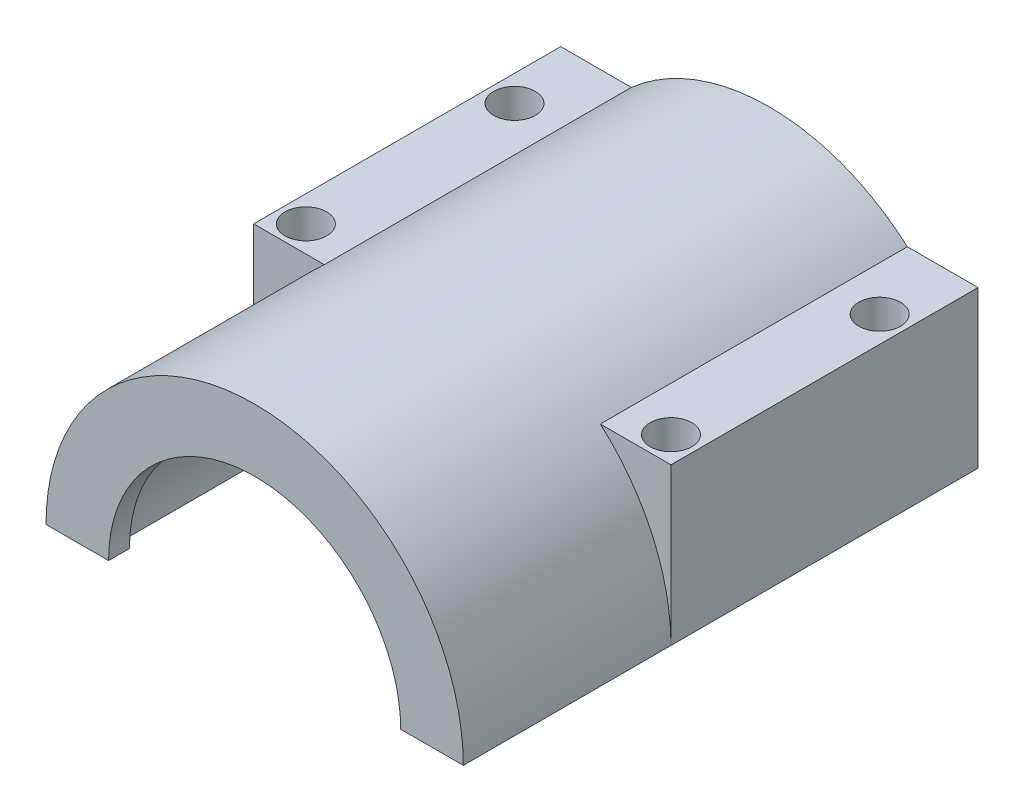
from build123d import *

# Parameters (mm, degrees)
BOSS_EXTRUDE1_DEPTH      = 52.578
BOSS_EXTRUDE2_START      = 5
BOSS_EXTRUDE2_DEPTH      = 5
SKETCH4_R                = 2.54
CUT_EXTRUDE1_DEPTH       = 64.677045189
SKETCH5_R                = 3.175
SKETCH5_R_2              = 2.54
BOSS_EXTRUDE3_DEPTH      = 19.05
BOSS_EXTRUDE4_REACH      = 63.421
BOSS_EXTRUDE4_END_RADIUS = 25.4
SKETCH6_W                = 8.89
SKETCH6_H                = 37.375
SKETCH6_R                = 2.54
BOSS_EXTRUDE5_DEPTH      = 2.54
BOSS_EXTRUDE6_DEPTH      = 2.54


with BuildPart() as part:
    # Sketch2 → Boss-Extrude1 (new body)
    with BuildSketch(Plane.XY):
        with BuildLine():
            Line((-19.05, 0), (-25.4, 0))
            ThreePointArc((-25.4, 0), (0, 25.4), (25.4, 0))
            Line((25.4, 0), (19.05, 0))
            ThreePointArc((19.05, 0), (0, 19.05), (-19.05, 0))
        make_face()
    extrude(amount=BOSS_EXTRUDE1_DEPTH)

    # Sketch3 → Boss-Extrude2 (add)
    with BuildSketch(Plane(origin=(0, 0, 0), x_dir=(-1, 0, 0), z_dir=(0, 0, -1)).offset(BOSS_EXTRUDE2_START)):
        with BuildLine():
            Line((-25.4, 0), (-13, 0))
            ThreePointArc((-13, 0), (-7, 6), (-1, 0))
            Line((-1, 0), (25.4, 0))
            ThreePointArc((25.4, 0), (0, 25.4), (-25.4, 0))
        make_face()
    extrude(amount=-BOSS_EXTRUDE2_DEPTH)

    # Sketch4 → Cut-Extrude1 (cut, through all)
    with BuildSketch(Plane(origin=(0, 0, 0), x_dir=(1, 0, 0), z_dir=(0, 1, 0))):
        with Locations((-22.225, -3.8)):
            Circle(SKETCH4_R)
        with Locations((22.225, -3.8)):
            Circle(SKETCH4_R)
        with Locations((22.225, -29.2)):
            Circle(SKETCH4_R)
        with Locations((-22.225, -29.2)):
            Circle(SKETCH4_R)
    extrude(amount=CUT_EXTRUDE1_DEPTH, mode=Mode.SUBTRACT)

    # Sketch5 → Boss-Extrude3 (add)
    # profile 1 of 4: a face of its own
    with BuildSketch(Plane.XZ):
        with Locations((-22.225, 29.2)):
            Circle(SKETCH5_R)
        with Locations((-22.225, 29.2)):
            Circle(SKETCH5_R_2, mode=Mode.SUBTRACT)
    # profile 2 of 4: a face of its own
    with BuildSketch(Plane.XZ):
        with Locations((-22.225, 3.8)):
            Circle(SKETCH5_R)
        with Locations((-22.225, 3.8)):
            Circle(SKETCH5_R_2, mode=Mode.SUBTRACT)
    # profile 3 of 4: a face of its own
    with BuildSketch(Plane.XZ):
        with Locations((22.225, 3.8)):
            Circle(SKETCH5_R)
        with Locations((22.225, 3.8)):
            Circle(SKETCH5_R_2, mode=Mode.SUBTRACT)
    # profile 4 of 4: a face of its own
    with BuildSketch(Plane.XZ):
        with Locations((22.225, 29.2)):
            Circle(SKETCH5_R)
        with Locations((22.225, 29.2)):
            Circle(SKETCH5_R_2, mode=Mode.SUBTRACT)
    extrude(amount=-BOSS_EXTRUDE3_DEPTH)

    # Boss-Extrude4: up to this cylinder (the profile starts outside it)
    boss_extrude4_end = Plane(origin=(0, 0, 13.296692), z_dir=(0, 0, -1)) * Cylinder(BOSS_EXTRUDE4_END_RADIUS, 178.642, mode=Mode.PRIVATE)
    # Sketch6 → Boss-Extrude4 (add, up to the surface)
    with BuildSketch(Plane(origin=(0, 19.05, 0), x_dir=(1, 0, 0), z_dir=(0, 1, 0)), mode=Mode.PRIVATE) as boss_extrude4_sk1:
        with Locations((20.955, -13.6875)):
            Rectangle(SKETCH6_W, SKETCH6_H)
        with Locations((22.225, -29.2)):
            Circle(SKETCH6_R, mode=Mode.SUBTRACT)
        with Locations((22.225, -3.8)):
            Circle(SKETCH6_R, mode=Mode.SUBTRACT)
    boss_extrude4_tool1 = extrude(boss_extrude4_sk1.sketch, amount=-BOSS_EXTRUDE4_REACH, mode=Mode.PRIVATE) - boss_extrude4_end
    boss_extrude4 = boss_extrude4_tool1.solids().sort_by_distance((20.778529, 19.05, 13.296692))[0]
    add(boss_extrude4)

    # Mirror1: Boss-Extrude4 across plane
    add(boss_extrude4.mirror(Plane(origin=(0, 0, 0), x_dir=(0, 0, 1), z_dir=(1, 0, 0))))

    # Sketch7 → Boss-Extrude5 (add)
    with BuildSketch(Plane.XY.offset(52.578)):
        with BuildLine():
            Line((19.05, 0), (25.4, 0))
            ThreePointArc((25.4, 0), (0, 25.4), (-25.4, 0))
            Line((-25.4, 0), (-19.05, 0))
            ThreePointArc((-19.05, 0), (0, 19.05), (19.05, 0))
        make_face()
    extrude(amount=BOSS_EXTRUDE5_DEPTH)

    # Sketch8 → Boss-Extrude6 (add)
    with BuildSketch(Plane.XY.offset(55.118)):
        with BuildLine():
            Line((-17.78, 0), (-25.4, 0))
            ThreePointArc((-25.4, 0), (0, 25.4), (25.4, 0))
            Line((25.4, 0), (17.78, 0))
            ThreePointArc((17.78, 0), (0, 17.78), (-17.78, 0))
        make_face()
    extrude(amount=BOSS_EXTRUDE6_DEPTH)


solid = part.part
